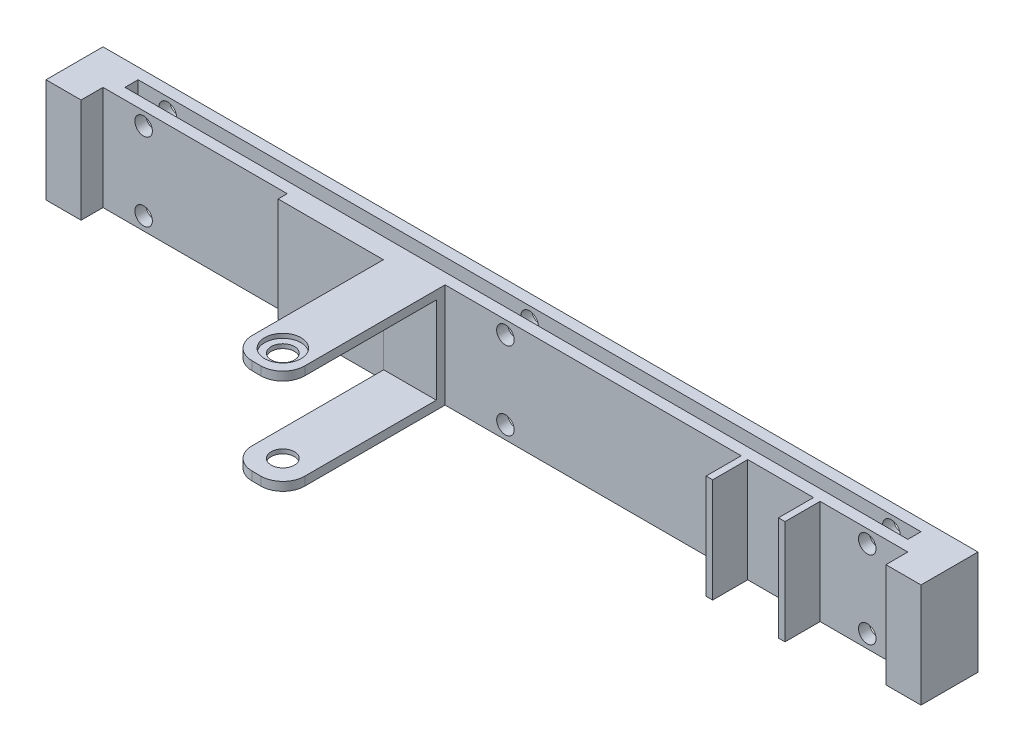
from build123d import *

# Parameters (mm, degrees)
SKETCH2_W            = 23.75
SKETCH2_H            = 12
BOSS_EXTRUDE1_DEPTH  = 10
SKETCH3_W            = 12
SKETCH3_H            = 1.975
BOSS_EXTRUDE2_DEPTH  = 35
FILLET1_R            = 5
FILLET1_OF_MIRROR1_R = 5
SKETCH5_R            = 2.65
CUT_EXTRUDE1_DEPTH   = 53.278700252
SKETCH6_R            = 4.15
CUT_EXTRUDE2_DEPTH   = 1
SKETCH7_W            = 74
SKETCH7_H            = 23.75
SKETCH7_W_2          = 113.5
BOSS_EXTRUDE3_DEPTH  = 8
SKETCH8_W            = 8
SKETCH8_H            = 23.75
BOSS_EXTRUDE4_DEPTH  = 5
SKETCH10_W           = 23.75
SKETCH10_H           = 2.075745243
BOSS_EXTRUDE5_DEPTH  = 24
SKETCH11_W           = 178.5
SKETCH11_H           = 3
CUT_EXTRUDE3_DEPTH   = 6
SKETCH12_R           = 2
CUT_EXTRUDE4_DEPTH   = 153.075486422
LPATTERN1_COUNT      = 3
LPATTERN1_PITCH      = 82.5
LPATTERN1_COUNT_DIR2 = 2
LPATTERN1_PITCH_DIR2 = 17.75
SKETCH14_W           = 1.5
SKETCH14_H           = 23.75
BOSS_EXTRUDE6_DEPTH  = 8


with BuildPart() as part:
    # Sketch2 → Boss-Extrude1 (new body)
    with BuildSketch(Plane(origin=(0, 0, 0), x_dir=(0, 1, 0), z_dir=(0, 0, 1))):
        with Locations((-83.125, 6)):
            Rectangle(SKETCH2_W, SKETCH2_H)
    extrude(amount=BOSS_EXTRUDE1_DEPTH)

    # Sketch3 → Boss-Extrude2 (add)
    with BuildSketch(Plane.XY.offset(10)):
        with Locations((-6, -72.2375)):
            Rectangle(SKETCH3_W, SKETCH3_H)
    boss_extrude2 = extrude(amount=BOSS_EXTRUDE2_DEPTH)

    # Fillet1
    fillet1_edges = [part.edges().sort_by_distance(p)[0] for p in [
        (0, -72.2375, 45),
        (-12, -72.2375, 45),
    ]]
    fillet(fillet1_edges, radius=FILLET1_R)

    # Mirror1: Boss-Extrude2 across plane
    add(boss_extrude2.mirror(Plane.ZX.offset(-83.125)))

    # Fillet1 of Mirror1
    fillet1_of_mirror1_edges = [part.edges().sort_by_distance(p)[0] for p in [
        (0, -94.0125, 45),
        (-12, -94.0125, 45),
    ]]
    fillet(fillet1_of_mirror1_edges, radius=FILLET1_OF_MIRROR1_R)

    # Sketch5 → Cut-Extrude1 (cut, through all)
    with BuildSketch(Plane.XZ.offset(95)):
        with Locations((-6, 39)):
            Circle(SKETCH5_R)
    extrude(amount=-CUT_EXTRUDE1_DEPTH, mode=Mode.SUBTRACT)

    # Sketch6 → Cut-Extrude2 (cut)
    with BuildSketch(Plane.XZ.offset(95)):
        with Locations((-6, 39)):
            Circle(SKETCH6_R)
    cut_extrude2 = extrude(amount=-CUT_EXTRUDE2_DEPTH, mode=Mode.SUBTRACT)

    # Mirror2: Cut-Extrude2 across plane
    add(cut_extrude2.mirror(Plane.ZX.offset(-83.125)), mode=Mode.SUBTRACT)

    # Sketch7 → Boss-Extrude3 (add)
    with BuildSketch(Plane(origin=(0, 0, 0), x_dir=(1, 0, 0), z_dir=(0, 0, -1))):
        with Locations((-49, 83.125)):
            Rectangle(SKETCH7_W, SKETCH7_H)
        with Locations((56.75, 83.125)):
            Rectangle(SKETCH7_W_2, SKETCH7_H)
    extrude(amount=-BOSS_EXTRUDE3_DEPTH)

    # Sketch8 → Boss-Extrude4 (add)
    with BuildSketch(Plane.XY.offset(8)):
        with Locations((109.5, -83.125)):
            Rectangle(SKETCH8_W, SKETCH8_H)
        with Locations((-82, -83.125)):
            Rectangle(SKETCH8_W, SKETCH8_H)
    extrude(amount=BOSS_EXTRUDE4_DEPTH)

    # Sketch10 → Boss-Extrude5 (add)
    with BuildSketch(Plane(origin=(-12, 0, 0), x_dir=(0, -1, 0), z_dir=(-1, 0, 0))):
        with Locations((83.125, 9.037872622)):
            Rectangle(SKETCH10_W, SKETCH10_H)
    extrude(amount=BOSS_EXTRUDE5_DEPTH)

    # Sketch11 → Cut-Extrude3 (cut)
    with BuildSketch(Plane(origin=(0, -71.25, 0), x_dir=(-1, 0, 0), z_dir=(0, 1, 0))):
        with Locations((-13.75, 4)):
            Rectangle(SKETCH11_W, SKETCH11_H)
    cut_extrude3 = extrude(amount=-CUT_EXTRUDE3_DEPTH, mode=Mode.SUBTRACT)

    # Mirror3: Cut-Extrude3 across plane
    add(cut_extrude3.mirror(Plane.ZX.offset(-83.125)), mode=Mode.SUBTRACT)

    # Sketch12 → Cut-Extrude4 (cut, symmetric)
    with BuildSketch(Plane.XY.offset(10.075745243)):
        with Locations((-68.75, -74.25)):
            Circle(SKETCH12_R)
    cut_extrude4 = extrude(amount=CUT_EXTRUDE4_DEPTH, both=True, mode=Mode.SUBTRACT)

    # LPattern1: Cut-Extrude4 3 × 2
    with Locations(*[(i * LPATTERN1_PITCH, -j * LPATTERN1_PITCH_DIR2, 0) for i in range(LPATTERN1_COUNT) for j in range(LPATTERN1_COUNT_DIR2) if (i, j) != (0, 0)]):
        add(cut_extrude4, mode=Mode.SUBTRACT)

    # Sketch14 → Boss-Extrude6 (add)
    with BuildSketch(Plane.XY.offset(8)):
        with Locations((84.75, -83.125)):
            Rectangle(SKETCH14_W, SKETCH14_H)
        with Locations((68.25, -83.125)):
            Rectangle(SKETCH14_W, SKETCH14_H)
    extrude(amount=BOSS_EXTRUDE6_DEPTH)


solid = part.part
